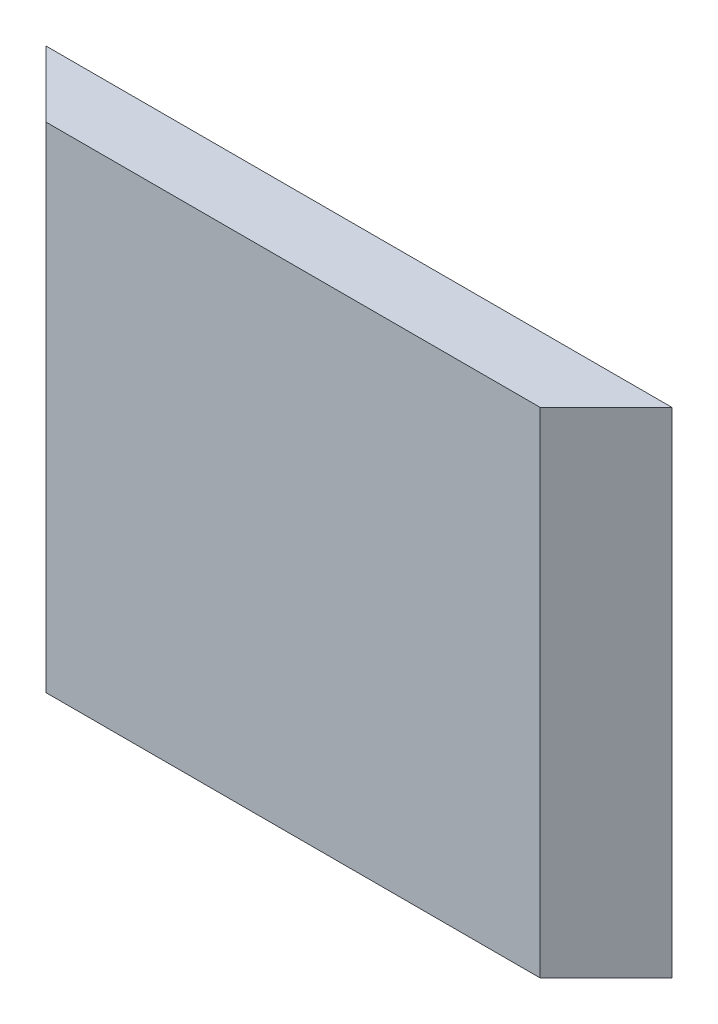
from build123d import *

# Parameters (mm, degrees)
SKETCH1_W           = 40
SKETCH1_H           = 30
BOSS_EXTRUDE1_DEPTH = 4
CHAMFER1_SIZE       = 5


with BuildPart() as part:
    # Sketch1 → Boss-Extrude1 (new body)
    with BuildSketch(Plane.XY):
        with Locations((-160.5, -15)):
            Rectangle(SKETCH1_W, SKETCH1_H)
    extrude(amount=BOSS_EXTRUDE1_DEPTH)

    # Chamfer1
    # the kernel refuses this chamfer: 5 mm, written as the material it takes off along each edge
    with BuildSketch(Plane(origin=(-180.5, -42.85841494, 4), x_dir=(-0.0274958766105877, 0, -0.9996219169112968), z_dir=(0, 1, 0)), Plane(origin=(-140.5, 12.85841494, 4), x_dir=(0.0274958766105877, 0, -0.9996219169112968), z_dir=(0, -1, 0))) as chamfer1_piece_1:
        Polygon((CHAMFER1_SIZE * 0.999621916911, -CHAMFER1_SIZE * 0.0274958766106), (-CHAMFER1_SIZE * 0.0274958766106, -CHAMFER1_SIZE * 0.999621916911), (0, 0), align=None)
    extrude(amount=55.71682988, mode=Mode.SUBTRACT)


solid = part.part
